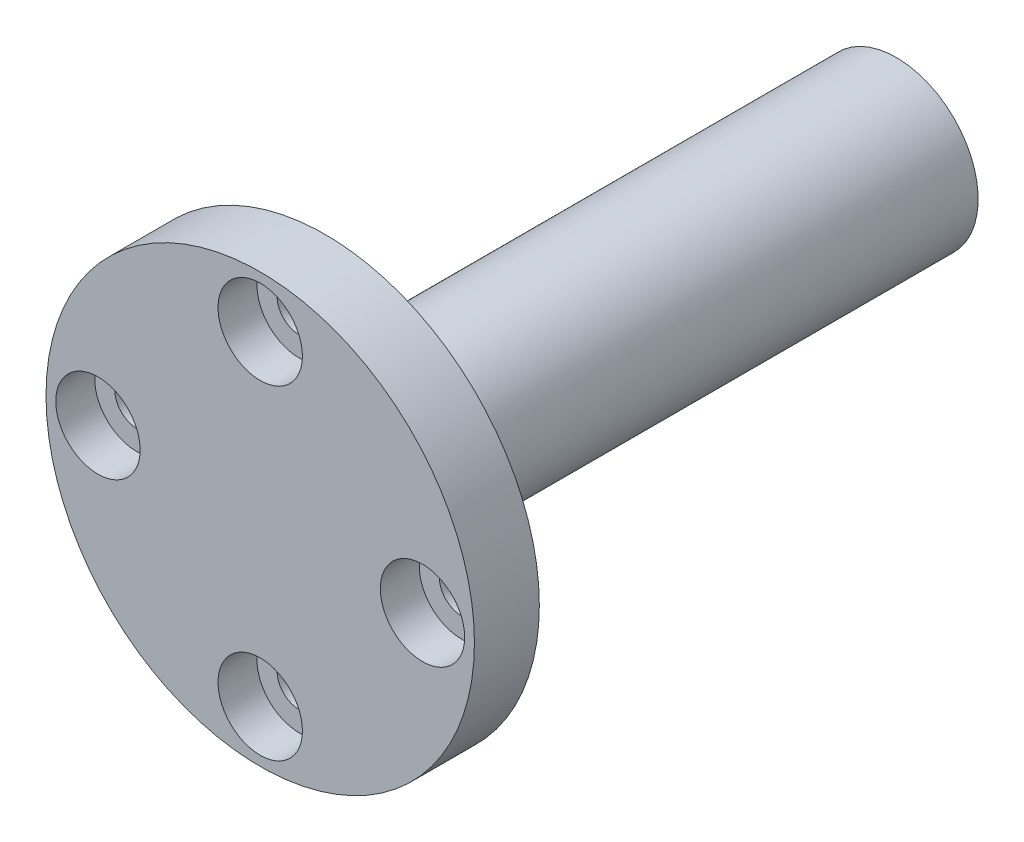
from build123d import *

# Parameters (mm, degrees)
HOLE_WIZARD_M31_D           = 3.4
HOLE_WIZARD_M31_CBORE_D     = 6.5
HOLE_WIZARD_M31_CBORE_DEPTH = 3
M3X0_51_D                   = 2.5
M3X0_51_DEPTH               = 15
M3X0_51_TIP                 = 0.751075774


with BuildPart() as part:
    # Эскиз2 → Повернуть1 (revolve)
    with BuildSketch(Plane(origin=(0, 0, 0), x_dir=(0, 0, -1), z_dir=(1, 0, 0))):
        Polygon((0, 0), (0, 16.5), (5, 16.5), (5, 6.3), (49, 6.3), (49, 0), align=None)
    revolve(axis=Axis((0, 0, -49), (0, 0, 1)))

    # Цековка для винта с внутренним шестигранником M31 (through all)
    with Locations(Plane.XY):
        with Locations((-12.5, 0), (0, 12.5), (12.5, 0), (0, -12.5)):
            CounterBoreHole(HOLE_WIZARD_M31_D / 2, HOLE_WIZARD_M31_CBORE_D / 2, HOLE_WIZARD_M31_CBORE_DEPTH)

    # Отверстие обработанное метчиком M3x0.51
    with Locations(Plane(origin=(2.706733298, -7.232806727, -49), x_dir=(-0.6355249951810988, -0.7720802940757291, 0), z_dir=(0, 0, -1))):
        with Locations((-3.864110878, 6.686444901)):
            Hole(M3X0_51_D / 2, depth=M3X0_51_DEPTH)
            with Locations((0, 0, -(M3X0_51_DEPTH + M3X0_51_TIP / 2))):  # 118° drill point
                Cone(0, M3X0_51_D / 2, M3X0_51_TIP, mode=Mode.SUBTRACT)


solid = part.part
